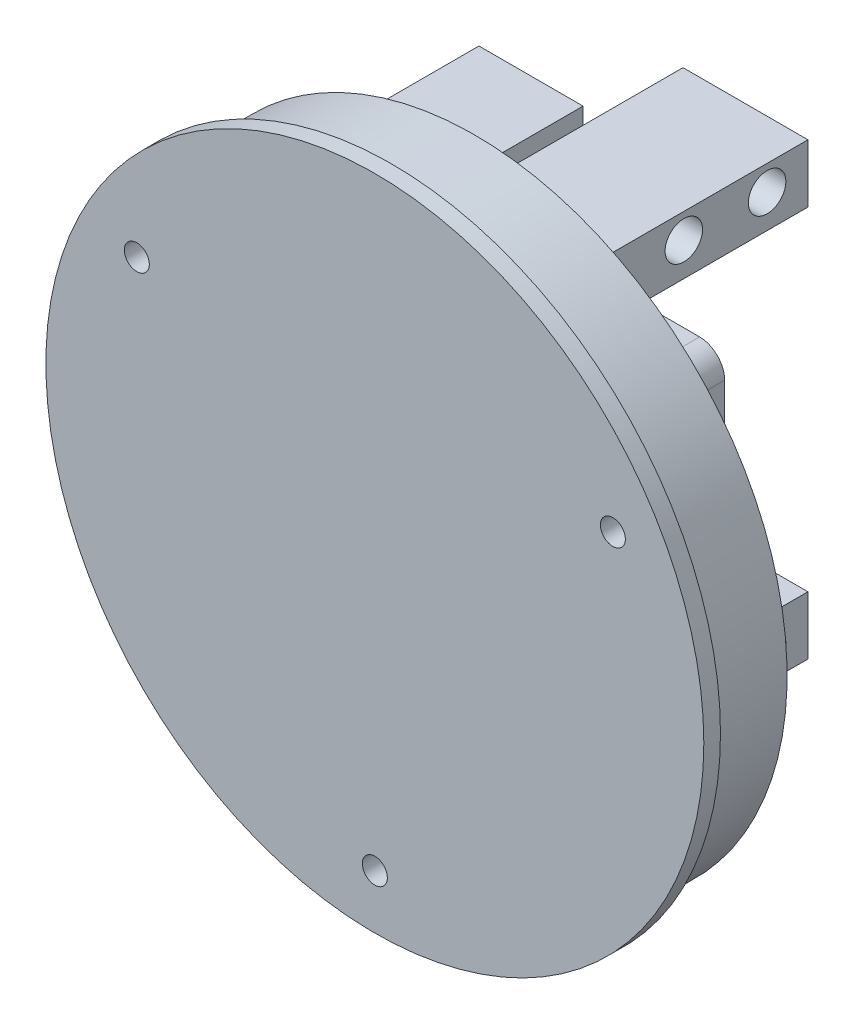
from build123d import *

# Parameters (mm, degrees)
SKETCH_1_R          = 37.5
EXTRUDE_3_DEPTH     = 14
SKETCH_2_R          = 39.5
SKETCH_2_R_2        = 37.5
EXTRUDE_4_DEPTH     = 2
EXTRUDE_START       = -2
SKETCH_3_R          = 39.5
SKETCH_3_R_2        = 37.5
EXTRUDE_5_DEPTH     = 2
SKETCH_4_R          = 39.5
CUT_EXTRUDE_1_DEPTH = 2
SKETCH_5_R          = 1.5
CUT_EXTRUDE_3_DEPTH = 58.135803136
SKETCH_6_W          = 40
SKETCH_6_H          = 40
EXTRUDE_6_DEPTH     = 10
SKETCH_7_W          = 15
SKETCH_7_H          = 7
EXTRUDE_7_DEPTH     = 30
SKETCH_8_W          = 3
SKETCH_8_H          = 14.2
EXTRUDE_9_DEPTH     = 10
EXTRUDE_10_DEPTH    = 20
SKETCH_10_R         = 1.5
CUT_EXTRUDE_4_DEPTH = 20
FILLET_1_R          = 3
EXTRUDE_START_2     = 6.5
SKETCH_11_W         = 22
SKETCH_11_H         = 14.2
SKETCH_11_R         = 1.5
EXTRUDE_11_DEPTH    = 6.5
CHAMFER_1_SIZE      = 6.5
SKETCH_12_R         = 3
CUT_EXTRUDE_5_DEPTH = 4
SKETCH_13_R         = 2.25
CUT_EXTRUDE_6_DEPTH = 10
SKETCH_15_R         = 2.25
CUT_EXTRUDE_7_DEPTH = 10


with BuildPart() as part:
    # 草图1 → 凸台-拉伸3 (new body)
    with BuildSketch(Plane.XY):
        Circle(SKETCH_1_R)
    extrude(amount=EXTRUDE_3_DEPTH)

    # 草图2 → 凸台-拉伸4 (add)
    with BuildSketch(Plane(origin=(0, 0, 0), x_dir=(-1, 0, 0), z_dir=(0, 0, -1))):
        Circle(SKETCH_2_R)
        Circle(SKETCH_2_R_2, mode=Mode.SUBTRACT)
    extrude(amount=-EXTRUDE_4_DEPTH)

    # 草图3 → 凸台-拉伸5 (add)
    with BuildSketch(Plane.XY.offset(14).offset(EXTRUDE_START)):
        with Locations(Location((0, 0, 0), (0, 0, 180))):
            Circle(SKETCH_3_R)
        with Locations(Location((0, 0, 0), (0, 0, 180))):
            Circle(SKETCH_3_R_2, mode=Mode.SUBTRACT)
    extrude(amount=EXTRUDE_5_DEPTH)

    # 草图4 → 切除-拉伸1 (cut)
    with BuildSketch(Plane(origin=(0, 0, 0), x_dir=(-1, 0, 0), z_dir=(0, 0, -1))):
        with Locations(Location((0, 0, 0), (0, 0, 180))):
            Circle(SKETCH_4_R)
    extrude(amount=-CUT_EXTRUDE_1_DEPTH, mode=Mode.SUBTRACT)

    # 草图5 → 切除-拉伸3 (cut, through all)
    with BuildSketch(Plane(origin=(0, 0, 2), x_dir=(-1, 0, 0), z_dir=(0, 0, -1))):
        with Locations((0, -33)):
            Circle(SKETCH_5_R)
        with Locations((-28.578838325, 16.5)):
            Circle(SKETCH_5_R)
        with Locations((28.578838325, 16.5)):
            Circle(SKETCH_5_R)
    extrude(amount=-CUT_EXTRUDE_3_DEPTH, mode=Mode.SUBTRACT)

    # 草图6 → 凸台-拉伸6 (add)
    with BuildSketch(Plane(origin=(0, 0, 2), x_dir=(-1, 0, 0), z_dir=(0, 0, -1))):
        Rectangle(SKETCH_6_W, SKETCH_6_H)
    extrude(amount=EXTRUDE_6_DEPTH)

    # 草图7 → 凸台-拉伸7 (add)
    with BuildSketch(Plane(origin=(0, 0, 2), x_dir=(-1, 0, 0), z_dir=(0, 0, -1))):
        with Locations((-2.5, -23.5)):
            Rectangle(SKETCH_7_W, SKETCH_7_H)
        with Locations((-2.5, 23.5)):
            Rectangle(SKETCH_7_W, SKETCH_7_H)
    extrude(amount=EXTRUDE_7_DEPTH)

    # 草图8 → 凸台-拉伸9 (add)
    with BuildSketch(Plane(origin=(0, 0, -8), x_dir=(-1, 0, 0), z_dir=(0, 0, -1))):
        with Locations((21.5, 9.9)):
            Rectangle(SKETCH_8_W, SKETCH_8_H)
        with Locations((18.5, 9.9)):
            Rectangle(SKETCH_8_W, SKETCH_8_H)
    extrude(amount=-EXTRUDE_9_DEPTH)

    # 草图9 → 凸台-拉伸10 (add)
    with BuildSketch(Plane(origin=(0, 0, -8), x_dir=(-1, 0, 0), z_dir=(0, 0, -1))):
        Polygon((23, 17), (17, 17), (17, 2.9), (23, 2.8), align=None)
    extrude(amount=EXTRUDE_10_DEPTH)

    # 草图10 → 切除-拉伸4 (cut)
    with BuildSketch(Plane.ZY.offset(23)):
        with Locations((-17.84, 9.9)):
            Circle(SKETCH_10_R)
    extrude(amount=-CUT_EXTRUDE_4_DEPTH, mode=Mode.SUBTRACT)

    # 圆角1
    fillet_1_edges = [part.edges().sort_by_distance(p)[0] for p in [
        (-20, -20, -3),
        (-20, 20, -3),
        (20, 20, -3),
        (20, -20, -3),
    ]]
    fillet(fillet_1_edges, radius=FILLET_1_R - 0.0001)  # a hair under: the kernel refuses the full size

    # 草图11 → 凸台-拉伸11 (add)
    with BuildSketch(Plane.ZY.offset(23).offset(EXTRUDE_START_2)):
        with Locations((-17, 9.9)):
            Rectangle(SKETCH_11_W, SKETCH_11_H)
        with Locations((-17.84, 9.9)):
            Circle(SKETCH_11_R, mode=Mode.SUBTRACT)
    extrude(amount=-EXTRUDE_11_DEPTH)

    # 倒角1
    chamfer_1_edges = [part.edges().sort_by_distance(p)[0] for p in [
        (-29.5, 9.9, -6),
    ]]
    chamfer(chamfer_1_edges, length=CHAMFER_1_SIZE - 0.0001)  # a hair under: the kernel refuses the full size

    # 草图12 → 切除-拉伸5 (cut)
    with BuildSketch(Plane(origin=(-17, 0, 0), x_dir=(0, 0, -1), z_dir=(1, 0, 0))):
        with Locations((17.84, 9.9)):
            Circle(SKETCH_12_R)
    extrude(amount=-CUT_EXTRUDE_5_DEPTH, mode=Mode.SUBTRACT)

    # 草图13 → 切除-拉伸6 (cut)
    with BuildSketch(Plane(origin=(10, 0, 0), x_dir=(0, 0, -1), z_dir=(1, 0, 0))):
        with Locations((23.1, -24)):
            Circle(SKETCH_13_R)
        with Locations((13.1, -24)):
            Circle(SKETCH_13_R)
    extrude(amount=-CUT_EXTRUDE_6_DEPTH, mode=Mode.SUBTRACT)

    # 草图15 → 切除-拉伸7 (cut)
    with BuildSketch(Plane(origin=(10, 0, 0), x_dir=(0, 0, -1), z_dir=(1, 0, 0))):
        with Locations((23.1, 24)):
            Circle(SKETCH_15_R)
        with Locations((13.1, 24)):
            Circle(SKETCH_15_R)
    extrude(amount=-CUT_EXTRUDE_7_DEPTH, mode=Mode.SUBTRACT)


solid = part.part
